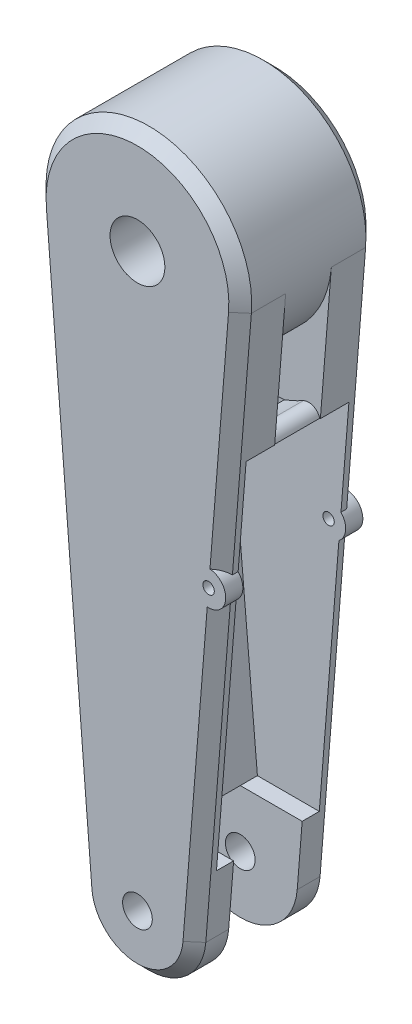
from build123d import *

# Parameters (mm, degrees)
SKETCH1_R                = 45
SKETCH1_R_2              = 12
BOSS_EXTRUDE1_DEPTH      = 30
SKETCH2_R                = 6.500000000000002
BOSS_EXTRUDE2_DEPTH      = 60.00000000000001
CUT_EXTRUDE1_DEPTH       = 15
CHAMFER1_SIZE            = 5
SKETCH4_R                = 68.57027417716169
CUT_EXTRUDE3_DEPTH       = 10
FILLET1_R                = 5
CUT_EXTRUDE4_DEPTH       = 281.26772914483035
CUT_EXTRUDE4_DEPTH_BACK  = 281.26772914483035
SKETCH5_R                = 2.5000000000000058
BOSS_EXTRUDE3_DEPTH      = 30
BOSS_EXTRUDE3_DEPTH_BACK = 30
SKETCH6_R                = 7.499999999999997
SKETCH6_R_2              = 2.5000000000000058
CUT_EXTRUDE5_DEPTH       = 22.5


with BuildPart() as part:
    # Sketch1 → Boss-Extrude1 (new, symmetric)
    with BuildSketch(Plane.XY):
        Circle(SKETCH1_R)
        Circle(SKETCH1_R_2, mode=Mode.SUBTRACT)
    extrude(amount=BOSS_EXTRUDE1_DEPTH, both=True)

    # Sketch2 → Boss-Extrude2 (add)
    with BuildSketch(Plane.XY.offset(30)):
        with BuildLine():
            Line((-44.85576885975762, -3.600000000000007), (-24.91987158875419, -252))
            ThreePointArc((-24.91987158875419, -252), (3.215e-14, -275), (24.91987158875426, -252))
            Line((24.91987158875426, -252), (44.85576885975761, -3.5999999999999956))
            ThreePointArc((44.85576885975761, -3.5999999999999956), (2.76e-15, -45.000000000000014), (-44.85576885975762, -3.600000000000007))
        make_face()
        with Locations((3.062e-14, -250)):
            Circle(SKETCH2_R, mode=Mode.SUBTRACT)
    extrude(amount=-BOSS_EXTRUDE2_DEPTH)

    # Sketch3 → Cut-Extrude1 (cut, symmetric)
    with BuildSketch(Plane.XY):
        with BuildLine():
            Line((-27.08681694429805, -225), (-24.91987158875419, -252))
            ThreePointArc((-24.91987158875419, -252), (3.215e-14, -275), (24.91987158875426, -252))
            Line((24.91987158875426, -252), (27.086816944298096, -225))
            Line((27.086816944298096, -225), (-27.08681694429805, -225))
        make_face()
    extrude(amount=CUT_EXTRUDE1_DEPTH, both=True, mode=Mode.SUBTRACT)

    # Chamfer1
    chamfer1_edges = [part.edges().sort_by_distance(p)[0] for p in [
        (-1.599e-14, 44.99999999999999, 30),
        (5.77e-15, 44.99999999999999, -29.99999999999991),
        (34.88782022425593, -127.8, -30.000000000000007),
        (3.042e-14, -275, -30.000000000000007),
        (-34.887820224255904, -127.80000000000001, -30.000000000000007),
        (-34.887820224255904, -127.80000000000001, 30),
        (3.042e-14, -275, 30),
        (34.88782022425593, -127.8, 30),
    ]]
    chamfer(chamfer1_edges, length=CHAMFER1_SIZE)

    # Sketch4 → Cut-Extrude3 (cut, symmetric)
    with BuildSketch(Plane.XY):
        Circle(SKETCH4_R)
        with BuildLine():
            ThreePointArc((44.99999999999999, 4.4e-16), (44.963927757087085, -1.8014440472726034), (44.8557688597576, -3.599999999999995))
            ThreePointArc((44.855768859757625, -3.600000000000005), (-8.27e-15, -45.00000000000002), (-44.855768859757625, -3.6000000000000085))
            ThreePointArc((-44.85576885975762, -3.6000000000000054), (-1.8014440472726134, 44.963927757087085), (44.99999999999999, 4.4e-16))
        make_face(mode=Mode.SUBTRACT)
    extrude(amount=CUT_EXTRUDE3_DEPTH, both=True, mode=Mode.SUBTRACT)

    # Fillet1
    # the kernel refuses this fillet: 5 mm, written as the material it takes off along each edge
    with BuildSketch(Plane(origin=(-40.716681036978386, -55.17276851911722, -10), x_dir=(0.07999999999999997, -0.9967948635501691, 0), z_dir=(0, 0, 1))) as fillet1_piece_1:
        with BuildLine():
            CenterArc((10.007537661154231, 4.999999999999998), FILLET1_R, 147.0642758003335, 122.9357241996666)
            ThreePointArc((5.81113251406956, 7.7184892572017425), (3.041676337682726, 3.7567694305680726), (0, 0))
            Line((0, 0), (10.007537661154236, 2e-17))
        make_face()
    extrude(amount=20, mode=Mode.SUBTRACT)
    with BuildSketch(Plane(origin=(40.7166810369784, -55.17276851911721, -10), x_dir=(-0.08000000000000003, -0.9967948635501691, 0), z_dir=(0, 0, 1))) as fillet1_piece_2:
        with BuildLine():
            CenterArc((10.007537661154224, -4.999999999999998), FILLET1_R, 89.99999999999993, 122.93572419966637)
            ThreePointArc((5.811132514069545, -7.718489257201729), (3.0416763376827105, -3.756769430568052), (0, 0))
            Line((0, 0), (10.00753766115423, -4e-17))
        make_face()
    extrude(amount=20, mode=Mode.SUBTRACT)

    # Sketch5 → Cut-Extrude4 (cut, two sides: drawn at the far end of the back side and taken through both)
    with BuildSketch(Plane.XY.offset(-CUT_EXTRUDE4_DEPTH_BACK)):
        with Locations(Location((31.135897271003447, -112.0487191029763, 0), (0, 0, 85.411434264))):
            Circle(SKETCH5_R)
    extrude(amount=CUT_EXTRUDE4_DEPTH + CUT_EXTRUDE4_DEPTH_BACK, mode=Mode.SUBTRACT)

    # Sketch6 → Boss-Extrude3 (add, two sides: drawn at the far end of the back side and taken through both)
    with BuildSketch(Plane.XY.offset(-BOSS_EXTRUDE3_DEPTH_BACK)):
        with Locations((31.135897271003447, -112.0487191029763)):
            Circle(SKETCH6_R)
        with Locations((31.135897271003447, -112.0487191029763)):
            Circle(SKETCH6_R_2, mode=Mode.SUBTRACT)
    extrude(amount=BOSS_EXTRUDE3_DEPTH + BOSS_EXTRUDE3_DEPTH_BACK)

    # Sketch8 → Cut-Extrude5 (cut, symmetric)
    with BuildSketch(Plane.XY):
        Polygon((39.65576885975762, -225), (39.655768859757615, -68.39166613076095), (40.05576885975761, -63.40769181301013), (0, -65.20900375479165), (-13.97990070496815, -65.20900375479165), (2.082e-14, -225), (27.086816944298096, -225), align=None)
    extrude(amount=CUT_EXTRUDE5_DEPTH, both=True, mode=Mode.SUBTRACT)


solid = part.part
